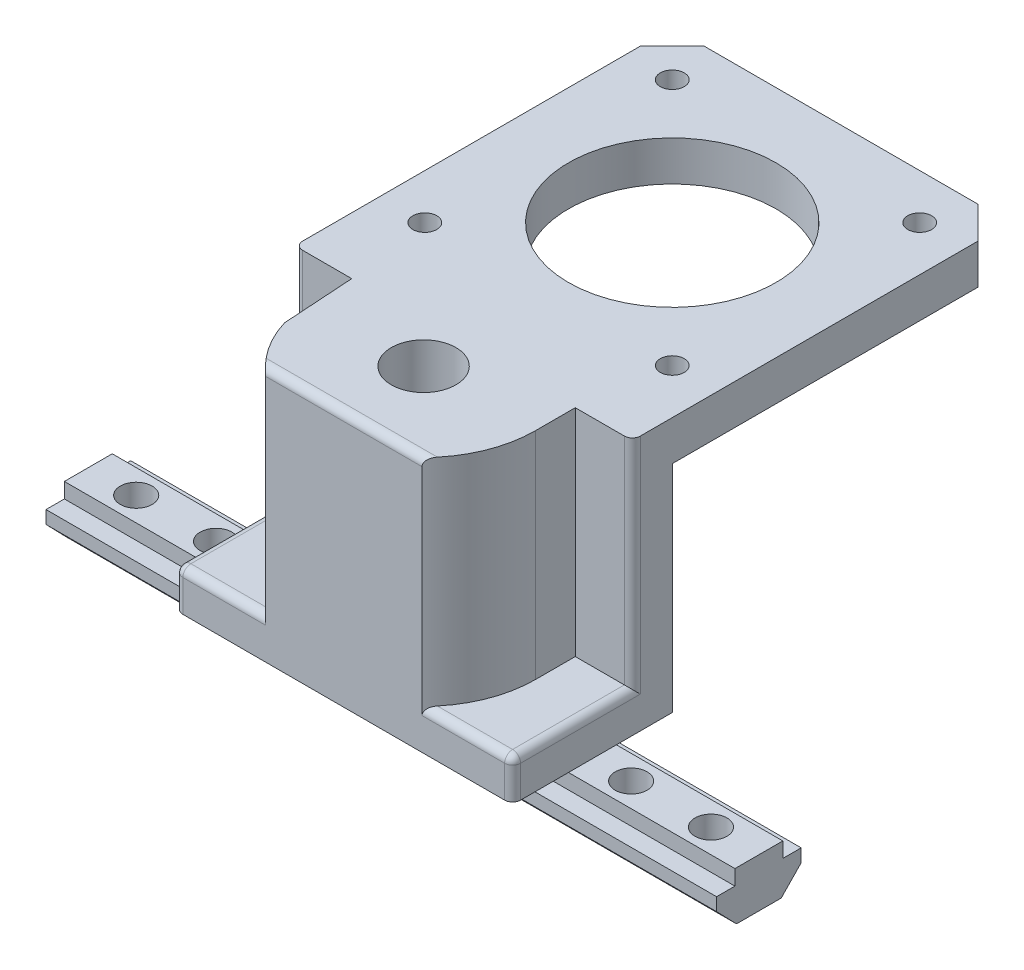
from build123d import *

# Parameters (mm, degrees)
BOSS_EXTRUDE1_DEPTH     = 42
SKETCH2_W               = 42.3
SKETCH2_H               = 20
BOSS_EXTRUDE2_DEPTH     = 32
SKETCH3_W               = 42.3
SKETCH3_H               = 42.3
BOSS_EXTRUDE3_DEPTH     = 5
SHELL2_START            = 11.1
SHELL2_OUTLINE_W        = 42.3
SHELL2_OUTLINE_H        = 15
SHELL2_DEPTH            = 27
CHAMFER2_SIZE           = 4
CUT_EXTRUDE1_DEPTH      = 75.799064165
CUT_EXTRUDE1_DEPTH_BACK = 75.799064165
SKETCH4_R               = 13
FILLET1_R               = 1
BOSS_EXTRUDE4_DEPTH     = 27
SKETCH18_R              = 4.05
CUT_EXTRUDE2_DEPTH      = 73.306915299
FILLET8_R               = 1
SKETCH19_R              = 1.5
CUT_EXTRUDE3_DEPTH      = 78.142076716
SKETCH20_R              = 2
CUT_EXTRUDE4_DEPTH      = 75.318840185


# Read off the part's stored shape, not the designer's step: Shell2
with BuildPart() as part:
    # Sketch1 → Boss-Extrude1 (new, symmetric)
    with BuildSketch(Plane(origin=(0, 0, 0), x_dir=(0, 0, -1), z_dir=(1, 0, 0))):
        Polygon((-3, 6.1), (3, 6.1), (3, 4.2), (5.3, 4.2), (5.3, 2.58), (2.8, 0), (-2.8, 0), (-5.3, 2.58), (-5.3, 4.2), (-3, 4.2), align=None)
    extrude(amount=BOSS_EXTRUDE1_DEPTH, both=True)

    # Sketch2 → Boss-Extrude2 (add)
    with BuildSketch(Plane(origin=(0, 6.1, 0), x_dir=(1, 0, 0), z_dir=(0, 1, 0))):
        Rectangle(SKETCH2_W, SKETCH2_H)
    extrude(amount=BOSS_EXTRUDE2_DEPTH)

    # Sketch3 → Boss-Extrude3 (add)
    with BuildSketch(Plane(origin=(0, 33.1, 0), x_dir=(1, 0, 0), z_dir=(0, 1, 0))):
        with Locations((0, 31.15)):
            Rectangle(SKETCH3_W, SKETCH3_H)
    extrude(amount=BOSS_EXTRUDE3_DEPTH)

    # Shell2 outline → Shell2 (cut)
    with BuildSketch(Plane(origin=(0, 0, 0), x_dir=(1, 0, 0), z_dir=(0, 1, 0)).offset(SHELL2_START)):
        with Locations((0, -2.5)):
            Rectangle(SHELL2_OUTLINE_W, SHELL2_OUTLINE_H)
    extrude(amount=SHELL2_DEPTH, mode=Mode.SUBTRACT)

    # Chamfer2
    chamfer2_edges = [part.edges().sort_by_distance(p)[0] for p in [
        (21.15, 35.6, -52.3),
        (-21.15, 35.6, -52.3),
    ]]
    chamfer(chamfer2_edges, length=CHAMFER2_SIZE)

    # Sketch4 → Cut-Extrude1 (cut, two sides: drawn at the far end of the back side and taken through both)
    with BuildSketch(Plane(origin=(0, 33.1, 0), x_dir=(1, 0, 0), z_dir=(0, 1, 0)).offset(-CUT_EXTRUDE1_DEPTH_BACK)):
        with Locations(Location((0, 31.15, 0), (0, 0, 270))):
            Circle(SKETCH4_R)
    extrude(amount=CUT_EXTRUDE1_DEPTH + CUT_EXTRUDE1_DEPTH_BACK, mode=Mode.SUBTRACT)

    # Fillet1
    fillet1_edges = [part.edges().sort_by_distance(p)[0] for p in [
        (-21.15, 8.6, 10),
        (21.15, 8.6, 10),
        (-21.15, 11.1, 2.5),
        (-21.15, 24.6, -5),
        (21.15, 11.1, 2.5),
        (21.15, 24.6, -5),
    ]]
    fillet(fillet1_edges, radius=FILLET1_R)

    # Sketch17 → Boss-Extrude4 (add)
    with BuildSketch(Plane(origin=(0, 11.1, 0), x_dir=(1, 0, 0), z_dir=(0, 1, 0))):
        with BuildLine():
            Line((14, 5), (-14, 5))
            Line((-14, 5), (-13.416407865, -4))
            ThreePointArc((-13.416407865, -4), (-11.98860738, -7.230027185), (-9.797958971, -10))
            Line((-9.797958971, -10), (9.797958971, -10))
            ThreePointArc((9.797958971, -10), (12.906808777, -5.423494003), (14, 0))
            Line((14, 0), (14, 5))
        make_face()
    extrude(amount=BOSS_EXTRUDE4_DEPTH)

    # Sketch18 → Cut-Extrude2 (cut, through all)
    with BuildSketch(Plane(origin=(0, 11.1, 0), x_dir=(1, 0, 0), z_dir=(0, 1, 0))):
        with Locations(Location((0, 0, 0), (0, 0, 270))):
            Circle(SKETCH18_R)
    extrude(amount=CUT_EXTRUDE2_DEPTH, mode=Mode.SUBTRACT)

    # Fillet8
    # the kernel refuses this fillet: 1 mm, written as the material it takes off along each edge
    with BuildSketch(Plane(origin=(-20.15, 10.1, 9), x_dir=(0, 1, 0), z_dir=(0, 0, 1))) as fillet8_piece_1_section:
        Polygon((0, 0), (FILLET8_R, 0), (FILLET8_R, FILLET8_R), (0, FILLET8_R), align=None)
    fillet8_piece_1 = extrude(amount=FILLET8_R, mode=Mode.PRIVATE)
    fillet8_piece_1 = fillet8_piece_1 - Plane(origin=(-20.15, 10.1, 9), x_dir=(0.7071067811865475, -0.7071067811865475, 0), z_dir=(0, 0, 1)) * Sphere(FILLET8_R, mode=Mode.PRIVATE)
    add(fillet8_piece_1, mode=Mode.SUBTRACT)
    with BuildSketch(Plane(origin=(20.15, 10.1, 9), x_dir=(0, 1, 0), z_dir=(0, 0, 1))) as fillet8_piece_2_section:
        Polygon((0, 0), (FILLET8_R, 0), (FILLET8_R, -FILLET8_R), (0, -FILLET8_R), align=None)
    fillet8_piece_2 = extrude(amount=FILLET8_R, mode=Mode.PRIVATE)
    fillet8_piece_2 = fillet8_piece_2 - Plane(origin=(20.15, 10.1, 9), x_dir=(-0.7071067811865475, -0.7071067811865475, 0), z_dir=(0, 0, 1)) * Sphere(FILLET8_R, mode=Mode.PRIVATE)
    add(fillet8_piece_2, mode=Mode.SUBTRACT)
    with BuildSketch(Plane(origin=(7.297958971, 11.1, 10), x_dir=(0, -1, 0), z_dir=(1, 0, 0))) as fillet8_piece_3_section:
        with BuildLine():
            CenterArc((FILLET8_R, FILLET8_R), FILLET8_R, 180, 90)
            Line((0, FILLET8_R), (0, 0))
            Line((0, 0), (FILLET8_R, 0))
        make_face()
    fillet8_piece_3 = extrude(amount=12.852041029, mode=Mode.PRIVATE)
    fillet8_piece_3 = fillet8_piece_3 - Plane(origin=(0, 10.87099501, 0), x_dir=(0.6998542122237654, 0, 0.7142857142857142), z_dir=(0, -1, 0)) * Cylinder(14, 30, mode=Mode.PRIVATE)
    add(fillet8_piece_3, mode=Mode.SUBTRACT)
    with BuildSketch(Plane(origin=(-12.297958971, 38.1, 10), x_dir=(0, 0, -1), z_dir=(1, 0, 0))) as fillet8_piece_4:
        with BuildLine():
            CenterArc((FILLET8_R, -FILLET8_R), FILLET8_R, 90, 90)
            Line((0, -FILLET8_R), (0, 0))
            Line((0, 0), (FILLET8_R, 0))
        make_face()
    extrude(amount=24.595917942, mode=Mode.SUBTRACT)
    with BuildSketch(Plane(origin=(-20.15, 11.1, 10), x_dir=(0, -1, 0), z_dir=(1, 0, 0))) as fillet8_piece_5_section:
        with BuildLine():
            CenterArc((FILLET8_R, FILLET8_R), FILLET8_R, 180, 90)
            Line((0, FILLET8_R), (0, 0))
            Line((0, 0), (FILLET8_R, 0))
        make_face()
    fillet8_piece_5 = extrude(amount=12.852041029, mode=Mode.PRIVATE)
    fillet8_piece_5 = fillet8_piece_5 - Plane(origin=(0, 10.870994427, 0), x_dir=(-0.9583148474999099, 0, 0.28571428571428575), z_dir=(0, -1, 0)) * Cylinder(14, 30, mode=Mode.PRIVATE)
    add(fillet8_piece_5, mode=Mode.SUBTRACT)

    # Sketch19 → Cut-Extrude3 (cut, through all)
    with BuildSketch(Plane(origin=(0, 38.1, 0), x_dir=(1, 0, 0), z_dir=(0, 1, 0))):
        with Locations(Location((-15.5, 46.65, 0), (0, 0, 270))):
            Circle(SKETCH19_R)
        with Locations(Location((15.5, 46.65, 0), (0, 0, 270))):
            Circle(SKETCH19_R)
        with Locations(Location((15.5, 15.65, 0), (0, 0, 270))):
            Circle(SKETCH19_R)
        with Locations(Location((-15.5, 15.65, 0), (0, 0, 270))):
            Circle(SKETCH19_R)
    extrude(amount=-CUT_EXTRUDE3_DEPTH, mode=Mode.SUBTRACT)

    # Sketch20 → Cut-Extrude4 (cut, through all)
    with BuildSketch(Plane(origin=(0, 6.1, 0), x_dir=(1, 0, 0), z_dir=(0, 1, 0))):
        with Locations(Location((36, 0, 0), (0, 0, 270))):
            Circle(SKETCH20_R)
        with Locations(Location((26, 0, 0), (0, 0, 270))):
            Circle(SKETCH20_R)
        with Locations(Location((-26, 0, 0), (0, 0, 270))):
            Circle(SKETCH20_R)
        with Locations(Location((-36, 0, 0), (0, 0, 270))):
            Circle(SKETCH20_R)
    extrude(amount=-CUT_EXTRUDE4_DEPTH, mode=Mode.SUBTRACT)


solid = part.part
